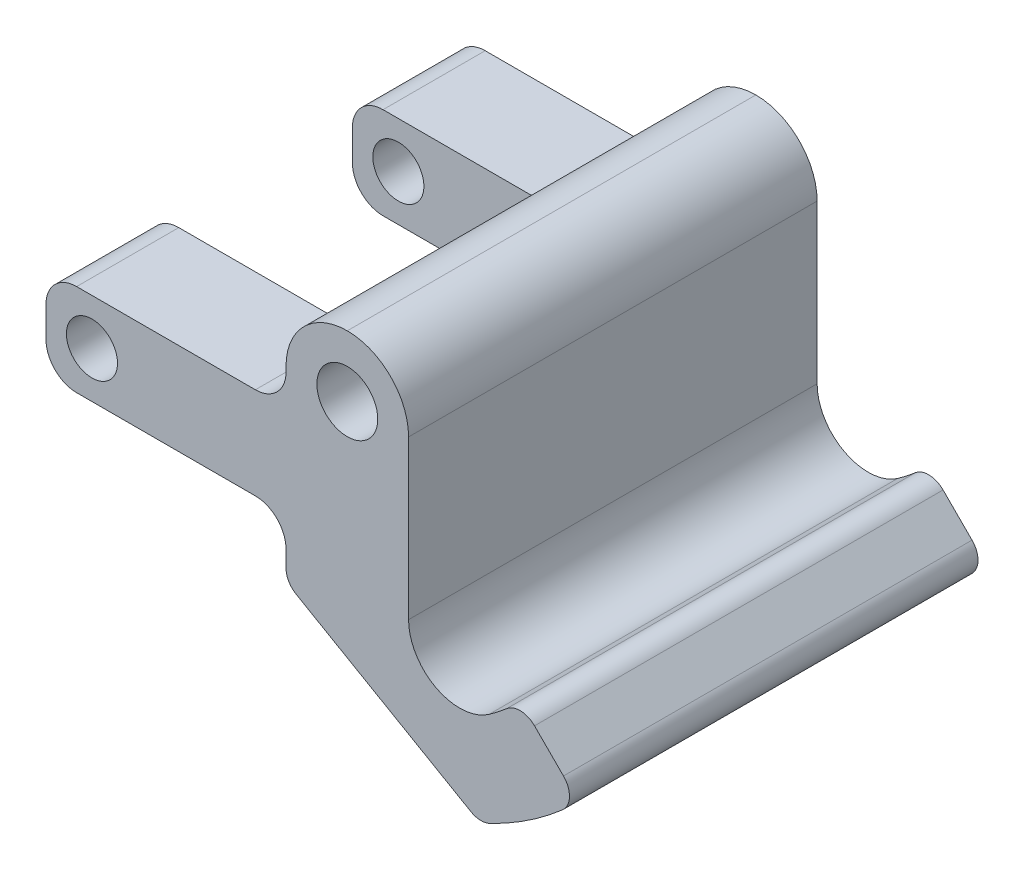
from build123d import *

# Parameters (mm, degrees)
SKETCH2_R            = 2.98
BOSS_EXTRUDE1_DEPTH  = 20
FILLET1_R            = 6
FILLET2_R            = 2
FILLET4_R            = 5
SKETCH3_W            = 23.5
SKETCH3_H            = 9
SKETCH3_R            = 2.5
BOSS_EXTRUDE2_DEPTH  = 10
FILLET3_R            = 3
FILLET3_OF_MIRROR1_R = 3


with BuildPart() as part:
    # Sketch2 → Boss-Extrude1 (new, symmetric)
    with BuildSketch(Plane.XY):
        with BuildLine():
            Line((-6, 6), (6, 6))
            Line((6, 6), (6, -23.237900077))
            ThreePointArc((6, -23.237900077), (11.905106784, -20.839108245), (16.970562748, -16.970562748))
            Line((16.970562748, -16.970562748), (22.627416998, -22.627416998))
            ThreePointArc((22.627416998, -22.627416998), (18.117975616, -26.376864096), (13, -29.240383034))
            Line((13, -29.240383034), (-6, -18.27072792))
            Line((-6, -18.27072792), (-6, 6))
        make_face()
        Circle(SKETCH2_R, mode=Mode.SUBTRACT)
    extrude(amount=BOSS_EXTRUDE1_DEPTH, both=True)

    # Fillet1
    fillet1_edges = [part.edges().sort_by_distance(p)[0] for p in [
        (6, 6, 0),
        (-6, 6, 0),
    ]]
    fillet(fillet1_edges, radius=FILLET1_R - 0.0001)  # a hair under: the kernel refuses the full size

    # Fillet2
    fillet2_edges = [part.edges().sort_by_distance(p)[0] for p in [
        (16.970562748, -16.970562748, 0),
        (22.627416998, -22.627416998, 0),
        (13, -29.240383034, 0),
        (-6, -18.27072792, 0),
    ]]
    fillet(fillet2_edges, radius=FILLET2_R)

    # Fillet4
    fillet4_edges = [part.edges().sort_by_distance(p)[0] for p in [
        (6, -23.237900077, 0),
    ]]
    fillet(fillet4_edges, radius=FILLET4_R)

    # Sketch3 → Boss-Extrude2 (add)
    with BuildSketch(Plane.XY.offset(20)):
        with Locations((-17.75, -8)):
            Rectangle(SKETCH3_W, SKETCH3_H)
        with Locations((-25, -8)):
            Circle(SKETCH3_R, mode=Mode.SUBTRACT)
    boss_extrude2 = extrude(amount=-BOSS_EXTRUDE2_DEPTH)

    # Fillet3
    fillet3_edges = [part.edges().sort_by_distance(p)[0] for p in [
        (-6, -3.5, 15),
        (-6, -12.5, 15),
        (-29.5, -12.5, 15),
        (-29.5, -3.5, 15),
    ]]
    fillet(fillet3_edges, radius=FILLET3_R)

    # Mirror1: Boss-Extrude2 across plane
    add(boss_extrude2.mirror(Plane.XY))

    # Fillet3 of Mirror1
    fillet3_of_mirror1_edges = [part.edges().sort_by_distance(p)[0] for p in [
        (-6, -3.5, -15),
        (-6, -12.5, -15),
        (-29.5, -12.5, -15),
        (-29.5, -3.5, -15),
    ]]
    fillet(fillet3_of_mirror1_edges, radius=FILLET3_OF_MIRROR1_R)


solid = part.part
